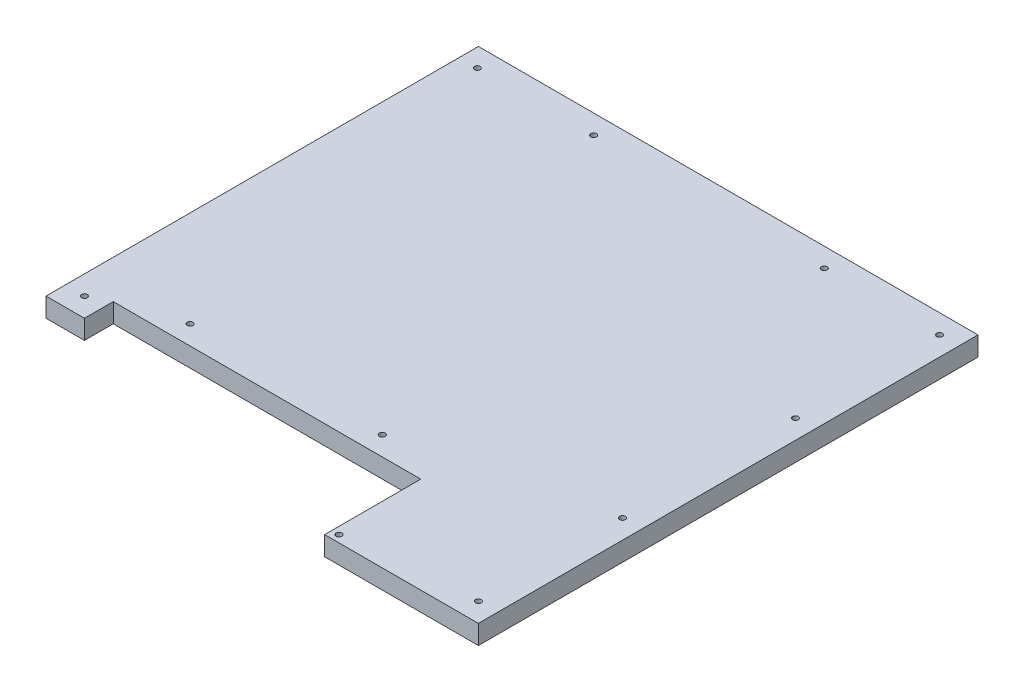
from build123d import *

# Parameters (mm, degrees)
BOSS_EXTRUDE1_DEPTH                 = 12.7
F_6_CLEARANCE_HOLE1_D               = 3.7973
F_6_CLEARANCE_HOLE3_NO_MOUNT_SIDE_D = 3.7973


with BuildPart() as part:
    # Sketch1 → Boss-Extrude1 (new body)
    with BuildSketch(Plane(origin=(0, 0, 0), x_dir=(1, 0, 0), z_dir=(0, 1, 0))):
        Polygon((-165.1, -120.65), (-165.1, 165.1), (165.1, 165.1), (165.1, -165.1), (63.5, -165.1), (63.5, -101.6), (-139.7, -101.6), (-139.7, -120.65), align=None)
    extrude(amount=BOSS_EXTRUDE1_DEPTH)

    # #6 Clearance Hole1 (through all)
    with Locations(Plane(origin=(-76.2, 12.7, -152.4), x_dir=(0, 0, 1), z_dir=(0, 1, 0))):
        with Locations((0, 0), (0, 152.4), (0, -76.8731), (0, 228.6), (304.8, 228.6), (312.7375, 144.4625), (260.35, -76.2), (241.3, -25.4), (241.3, 101.6)):
            Hole(F_6_CLEARANCE_HOLE1_D / 2)

    # #6 Clearance Hole3 - No Mount Side (through all)
    with Locations(Plane(origin=(152.4, 12.7, -57.15), x_dir=(0, 0, 1), z_dir=(0, 1, 0))):
        with Locations((0, 0), (114.3, 0)):
            Hole(F_6_CLEARANCE_HOLE3_NO_MOUNT_SIDE_D / 2)


solid = part.part
